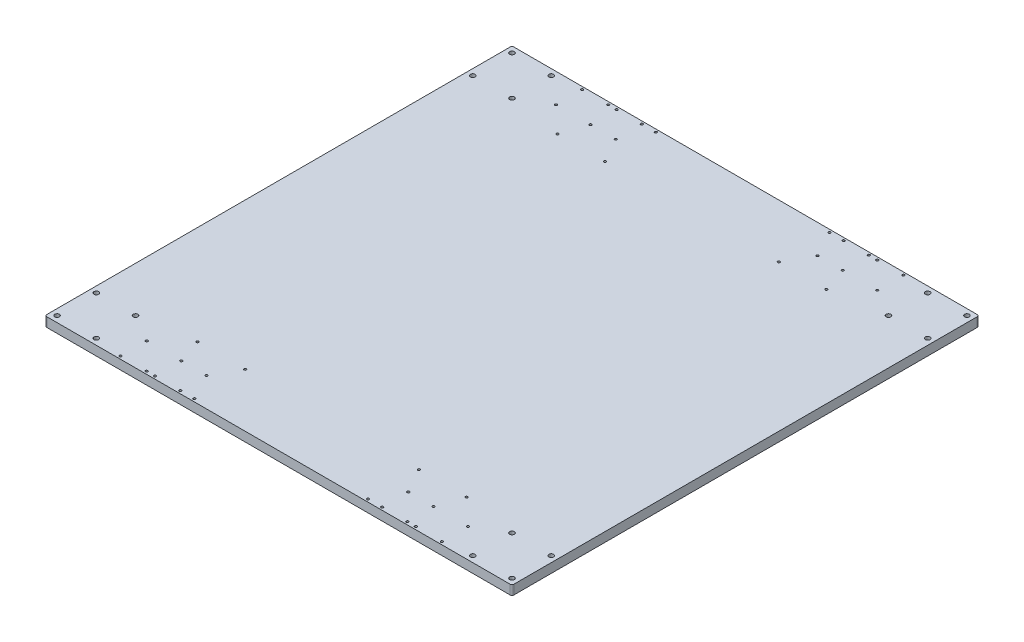
from build123d import *

# Parameters (mm, degrees)
SKETCH1_W                   = 500
SKETCH1_H                   = 500
BOSS_EXTRUDE1_DEPTH         = 10
TAP_DRILL_FOR_M3X0_5_TAP1_D = 2.5
TAP_DRILL_FOR_M6X1_0_TAP1_D = 5
CIRPATTERN1_COUNT           = 4
FILLET1_R                   = 2


with BuildPart() as part:
    # Sketch1 → Boss-Extrude1 (new body)
    with BuildSketch(Plane(origin=(0, 0, 0), x_dir=(1, 0, 0), z_dir=(0, 1, 0))):
        Rectangle(SKETCH1_W, SKETCH1_H)
    extrude(amount=BOSS_EXTRUDE1_DEPTH)

    # Tap Drill for M3x0.5 Tap1 (through all)
    with Locations(Plane(origin=(0, 10, 0), x_dir=(1, 0, 0), z_dir=(0, 1, 0))):
        with Locations((172, -219), (172, -247), (108, -247), (108, -219), (-108, -219), (-172, -219), (-172, -247), (-108, -247), (-108, 219), (-108, 247), (-172, 247), (-172, 219), (108, 247), (172, 247), (172, 219), (108, 219), (-144, 247), (-93, 247), (-93, 192.6), (-144, 192.6), (93, 247), (144, 247), (144, 192.6), (93, 192.6), (93, -192.6), (144, -192.6), (144, -247), (93, -247), (-144, -192.6), (-93, -192.6), (-93, -247), (-144, -247), (-135, -219), (-135, -247), (135, -219), (135, -247), (135, 219), (135, 247), (-135, 219), (-135, 247)):
            Hole(TAP_DRILL_FOR_M3X0_5_TAP1_D / 2)

    # Tap Drill for M6x1.0 Tap1 (through all)
    with Locations(Plane(origin=(0, 10, 0), x_dir=(1, 0, 0), z_dir=(0, 1, 0))):
        with Locations((243.5, -243.5), (201.5, -201.5), (243.5, -201.5), (201.5, -243.5)):
            tap_drill_for_m6x1_0_tap1 = Hole(TAP_DRILL_FOR_M6X1_0_TAP1_D / 2)

    # CirPattern1: Tap Drill for M6x1.0 Tap1 ×4 about axis
    cirpattern1_axis = Axis((0, 10.5, 0), (0, -1, 0))
    for i in range(1, CIRPATTERN1_COUNT):
        add(tap_drill_for_m6x1_0_tap1.rotate(cirpattern1_axis, i * 360 / CIRPATTERN1_COUNT), mode=Mode.SUBTRACT)

    # Fillet1
    fillet1_edges = [part.edges().sort_by_distance(p)[0] for p in [
        (250, 5, -250),
        (250, 5, 250),
        (-250, 5, 250),
        (-250, 5, -250),
    ]]
    fillet(fillet1_edges, radius=FILLET1_R)


solid = part.part
